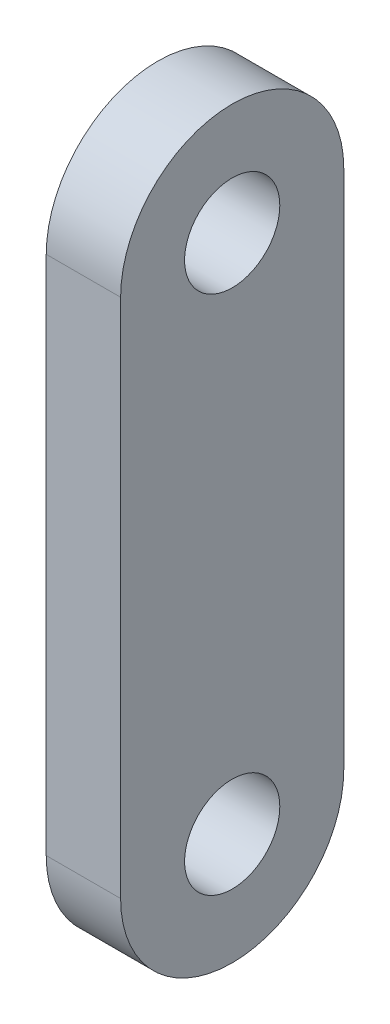
from build123d import *

# Parameters (mm, degrees)
SKETCH1_R           = 2.032
BOSS_EXTRUDE1_DEPTH = 3.175


with BuildPart() as part:
    # Sketch1 → Boss-Extrude1 (new body)
    with BuildSketch(Plane(origin=(0, 0, 0), x_dir=(0, 0, -1), z_dir=(1, 0, 0))):
        with BuildLine():
            Line((-4.7625, 0), (-4.7625, 22.225))
            ThreePointArc((-4.7625, 22.225), (0, 26.9875), (4.7625, 22.225))
            Line((4.7625, 22.225), (4.7625, 0))
            ThreePointArc((4.7625, 0), (0, -4.7625), (-4.7625, 0))
        make_face()
        with Locations((0, 22.225)):
            Circle(SKETCH1_R, mode=Mode.SUBTRACT)
        Circle(SKETCH1_R, mode=Mode.SUBTRACT)
    extrude(amount=BOSS_EXTRUDE1_DEPTH)


solid = part.part
